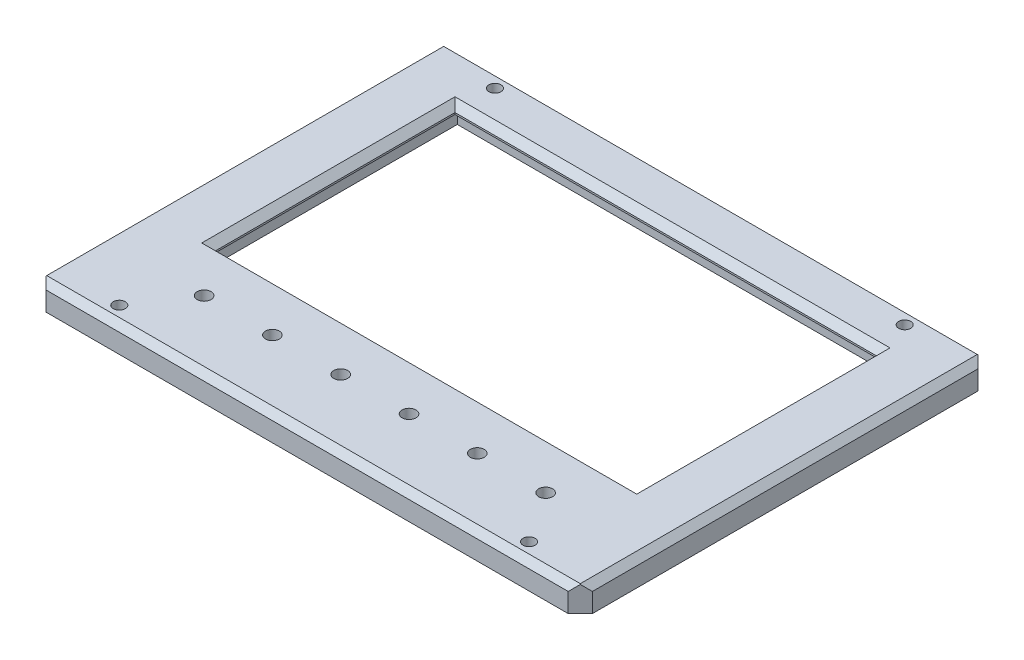
from build123d import *

# Parameters (mm, degrees)
SKETCH1_W             = 203.2
SKETCH1_H             = 152.4
BOSS_EXTRUDE1_DEPTH   = 9.525
SKETCH2_W             = 156.7
SKETCH2_H             = 89.1
CUT_EXTRUDE1_DEPTH    = 128.356686613
CHAMFER1_SIZE         = 2.54
SKETCH3_W             = 164.9
SKETCH3_H             = 100
CUT_EXTRUDE2_DEPTH    = 6.35
SKETCH4_R             = 2.5796875
CUT_EXTRUDE3_DEPTH    = 128.356686613
CHAMFER2_SIZE         = 2.38125
F_8_CLEARANCE_HOLE1_D = 4.4958
CHAMFER3_SIZE         = 4.4958


with BuildPart() as part:
    # Sketch1 → Boss-Extrude1 (new body)
    with BuildSketch(Plane(origin=(0, 0, 0), x_dir=(1, 0, 0), z_dir=(0, 1, 0))):
        Rectangle(SKETCH1_W, SKETCH1_H)
    extrude(amount=BOSS_EXTRUDE1_DEPTH)

    # Sketch2 → Cut-Extrude1 (cut, through all)
    with BuildSketch(Plane(origin=(0, 9.525, 0), x_dir=(1, 0, 0), z_dir=(0, 1, 0))):
        with Locations((0, 12.6)):
            Rectangle(SKETCH2_W, SKETCH2_H)
    extrude(amount=-CUT_EXTRUDE1_DEPTH, mode=Mode.SUBTRACT)

    # Chamfer1
    chamfer1_edges = [part.edges().sort_by_distance(p)[0] for p in [
        (78.35, 9.525, -12.6),
        (0, 9.525, 31.95),
        (-78.35, 9.525, -12.6),
        (0, 9.525, -57.15),
    ]]
    chamfer(chamfer1_edges, length=CHAMFER1_SIZE)

    # Sketch3 → Cut-Extrude2 (cut)
    with BuildSketch(Plane(origin=(-44.720558265, 0, -165.453357273), x_dir=(1, 0, 0), z_dir=(0, -1, 0))):
        with Locations((46.110558265, 154.733357273)):
            Rectangle(SKETCH3_W, SKETCH3_H)
    extrude(amount=-CUT_EXTRUDE2_DEPTH, mode=Mode.SUBTRACT)

    # Sketch4 → Cut-Extrude3 (cut, through all)
    with BuildSketch(Plane(origin=(0, 9.525, 0), x_dir=(1, 0, 0), z_dir=(0, 1, 0))):
        with Locations((-63.5, -51)):
            Circle(SKETCH4_R)
        with Locations((-38.1, -51)):
            Circle(SKETCH4_R)
        with Locations((-12.7, -51)):
            Circle(SKETCH4_R)
        with Locations((12.7, -51)):
            Circle(SKETCH4_R)
        with Locations((38.1, -51)):
            Circle(SKETCH4_R)
        with Locations((63.5, -51)):
            Circle(SKETCH4_R)
    extrude(amount=-CUT_EXTRUDE3_DEPTH, mode=Mode.SUBTRACT)

    # Chamfer2
    chamfer2_edges = [part.edges().sort_by_distance(p)[0] for p in [
        (101.6, 9.525, 0),
        (0, 9.525, 76.2),
        (0, 9.525, -76.2),
        (-101.6, 9.525, 0),
    ]]
    chamfer(chamfer2_edges, length=CHAMFER2_SIZE)

    # #8 Clearance Hole1 (through all)
    with Locations(Plane(origin=(0, 9.525, 0), x_dir=(1, 0, 0), z_dir=(0, 1, 0))):
        with Locations((-76.2, 69.85), (76.2, 69.85), (76.2, -69.85), (-76.2, -69.85)):
            Hole(F_8_CLEARANCE_HOLE1_D / 2)

    # Chamfer3
    chamfer3_edges = [part.edges().sort_by_distance(p)[0] for p in [
        (101.6, 3.571875, -76.2),
        (-101.6, 3.571875, -76.2),
        (-101.6, 3.571875, 76.2),
        (101.6, 3.571875, 76.2),
    ]]
    chamfer(chamfer3_edges, length=CHAMFER3_SIZE)


solid = part.part
